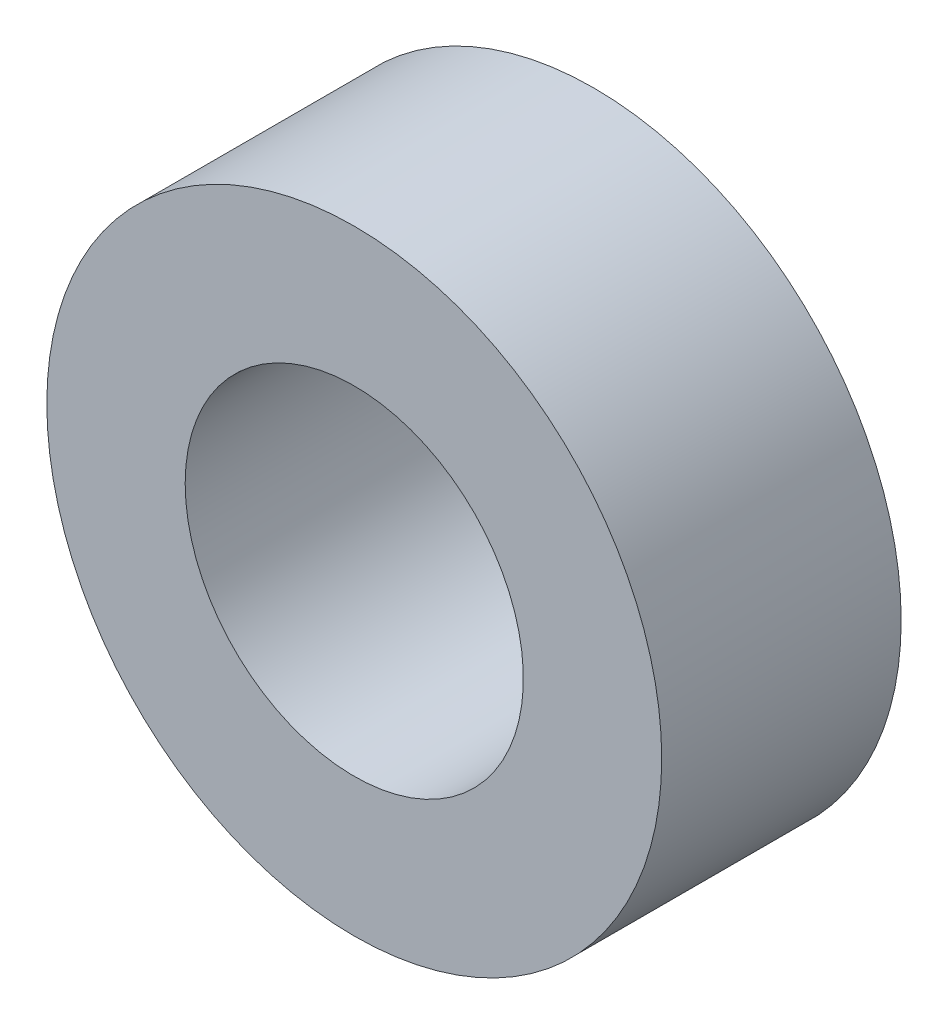
from build123d import *

# Parameters (mm, degrees)
SKETCH1_R           = 9.525
SKETCH1_R_2         = 5.23875
BOSS_EXTRUDE1_DEPTH = 3.709253313


with BuildPart() as part:
    # Sketch1 → Boss-Extrude1 (new, symmetric)
    with BuildSketch(Plane.XY):
        Circle(SKETCH1_R)
        Circle(SKETCH1_R_2, mode=Mode.SUBTRACT)
    extrude(amount=BOSS_EXTRUDE1_DEPTH, both=True)


solid = part.part
